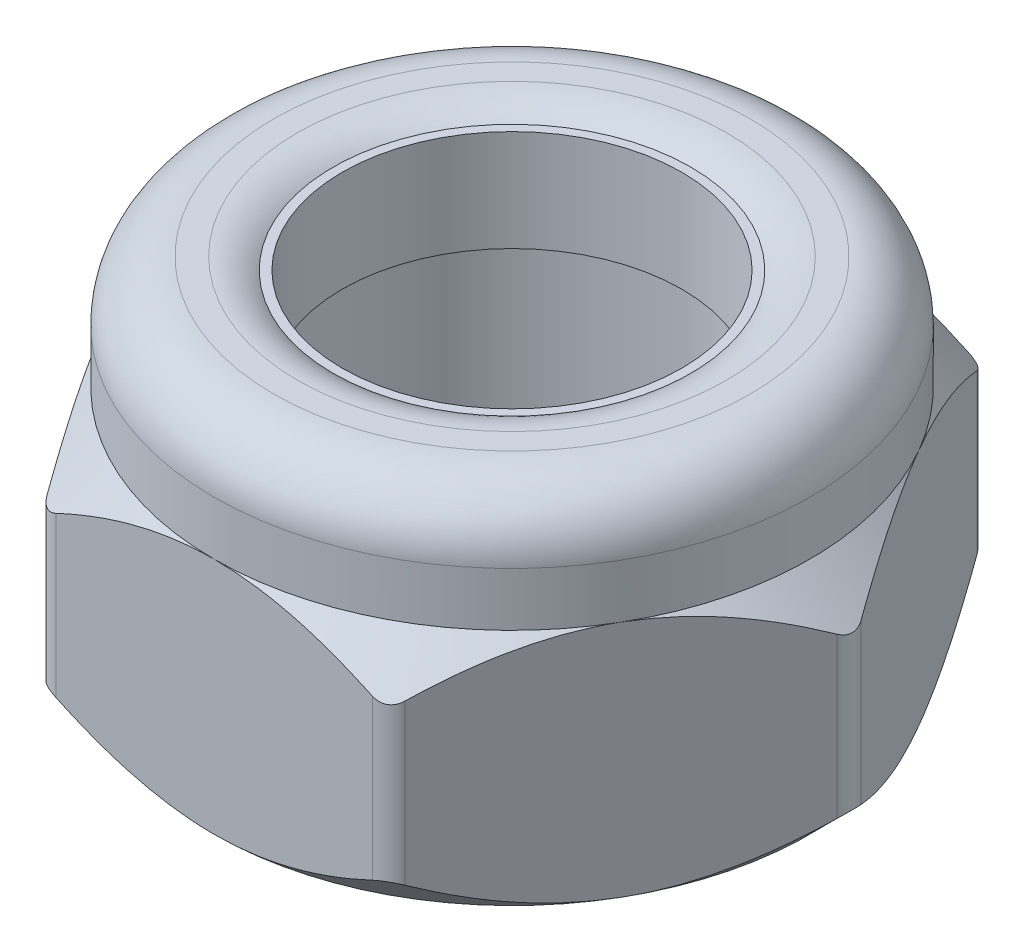
from build123d import *

# Parameters (mm, degrees)
EXTRUDE_1_DEPTH     = 2
SKETCH_3_R          = 5
EXTRUDE_2_DEPTH     = 1.9
SKETCH_4_R          = 3
CUT_EXTRUDE_1_DEPTH = 10.651079387
EXTRUDE_START       = -0.2
SKETCH_5_R          = 3
SKETCH_5_R_2        = 2.85
EXTRUDE_3_DEPTH     = 1.7
FILLET_1_R          = 1
FILLET_3_R          = 0.4


with BuildPart() as part:
    # 草图1 → 凸台-拉伸1 (new, symmetric)
    with BuildSketch(Plane(origin=(0, 0, 0), x_dir=(1, 0, 0), z_dir=(0, 1, 0))):
        Polygon((5.773502692, 0), (2.886751346, 5), (-2.886751346, 5), (-5.773502692, 0), (-2.886751346, -5), (2.886751346, -5), align=None)
    extrude(amount=EXTRUDE_1_DEPTH, both=True)

    # 草图3 → 凸台-拉伸2 (add)
    with BuildSketch(Plane(origin=(0, 2, 0), x_dir=(1, 0, 0), z_dir=(0, 1, 0))):
        with Locations(Location((0, 0, 0), (0, 0, 270))):
            Circle(SKETCH_3_R)
    extrude(amount=EXTRUDE_2_DEPTH)

    # 草图4 → 切除-拉伸1 (cut, through all)
    with BuildSketch(Plane(origin=(0, 3.9, 0), x_dir=(1, 0, 0), z_dir=(0, 1, 0))):
        with Locations(Location((0, 0, 0), (0, 0, 270))):
            Circle(SKETCH_4_R)
    extrude(amount=-CUT_EXTRUDE_1_DEPTH, mode=Mode.SUBTRACT)

    # 草图5 → 凸台-拉伸3 (add)
    with BuildSketch(Plane(origin=(0, 3.9, 0), x_dir=(1, 0, 0), z_dir=(0, 1, 0)).offset(EXTRUDE_START)):
        with Locations(Location((0, 0, 0), (0, 0, 270))):
            Circle(SKETCH_5_R)
        with Locations(Location((0, 0, 0), (0, 0, 270))):
            Circle(SKETCH_5_R_2, mode=Mode.SUBTRACT)
    extrude(amount=-EXTRUDE_3_DEPTH)

    # 圆角1
    # the kernel refuses this fillet: 1 mm, written as the material it takes off along each edge
    with BuildSketch(Plane(origin=(0, 3.9, 0), x_dir=(0, 0, 1), z_dir=(-1, 0, 0))) as fillet_1_piece_1:
        with BuildLine():
            CenterArc((5 - FILLET_1_R, -FILLET_1_R), FILLET_1_R, 0, 90)
            Line((5 - FILLET_1_R, 0), (5 - FILLET_1_R, FILLET_1_R * 0.02))
            Line((5 - FILLET_1_R, FILLET_1_R * 0.02), (5 + FILLET_1_R * 0.02, FILLET_1_R * 0.02))
            Line((5 + FILLET_1_R * 0.02, FILLET_1_R * 0.02), (5 + FILLET_1_R * 0.02, -FILLET_1_R))
            Line((5 + FILLET_1_R * 0.02, -FILLET_1_R), (5, -FILLET_1_R))
        make_face()
    revolve(axis=Axis((0, 3.9, 0), (0, 1, 0)), mode=Mode.SUBTRACT)
    with BuildSketch(Plane(origin=(0, 3.9, 0), x_dir=(0, 0, 1), z_dir=(-1, 0, 0))) as fillet_1_piece_2:
        with BuildLine():
            CenterArc((3.6, -1), FILLET_1_R, 90, 36.869897646)
            Line((3, -0.2), (2.988, -0.184))
            ThreePointArc((2.988, -0.184), (2.98, -0.1), (2.98, 0))
            Line((2.98, 0), (3, 0.02))
            Line((3, 0.02), (3.6, 0.02))
            Line((3.6, 0.02), (3.6, 0))
        make_face()
    revolve(axis=Axis((0, 3.9, 0), (0, 1, 0)), mode=Mode.SUBTRACT)

    # 草图6 → 切除-旋转1 (revolve, cut)
    with BuildSketch(Plane.XY):
        Polygon((-5.773502692, 2), (-5.773502692, 1.226497308), (-5, 2), align=None)
        Polygon((-5.773502692, -2), (-5.773502692, -1.226497308), (-5, -2), align=None)
    revolve(axis=Axis((0, -1000, 0), (0, 1, 0)), mode=Mode.SUBTRACT)

    # 圆角3
    fillet_3_edges = [part.edges().sort_by_distance(p)[0] for p in [
        (-5.773502692, 0, 0),
        (-2.886751346, 0, -5),
        (2.886751346, 0, -5),
        (5.773502692, 0, 0),
        (2.886751346, 0, 5),
        (-2.886751346, 0, 5),
    ]]
    fillet(fillet_3_edges, radius=FILLET_3_R)


solid = part.part
